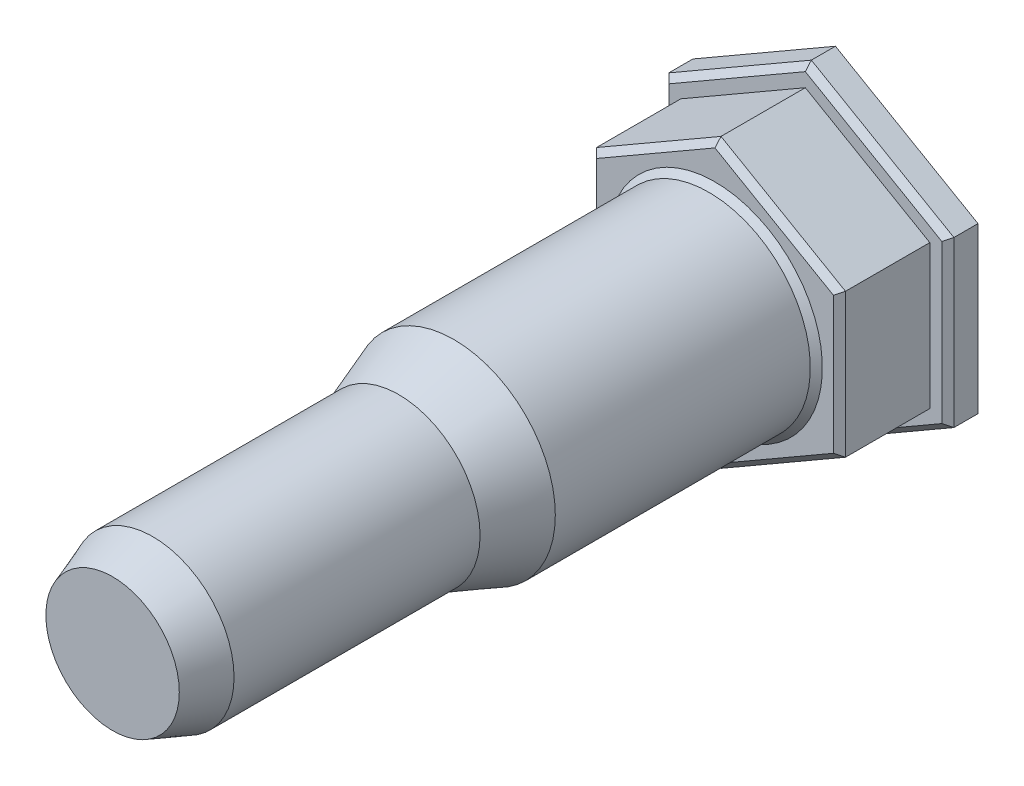
from build123d import *

# Parameters (mm, degrees)
BOSS_EXTRUDE1_DEPTH = 1.5
SKETCH1_8_R         = 4.05
BOSS_EXTRUDE3_DEPTH = 36
SKETCH1_9_R         = 5.05
BOSS_EXTRUDE4_DEPTH = 19
SHELL1_START        = 2
SHELL1_OUTLINE_R    = 3.05
SHELL1_DEPTH        = 15
SHELL1_START_2      = 17
SHELL1_2_OUTLINE_R  = 2.05
SHELL1_2_DEPTH      = 17
SKETCH1_10_R        = 3.05
CUT_EXTRUDE1_DEPTH  = 11
SKETCH1_3_R         = 3.05
BOSS_EXTRUDE2_DEPTH = 6
CHAMFER1_SIZE       = 2
CHAMFER1_SIZE2      = 0.727940469
CHAMFER2_SIZE       = 2.747477419
CHAMFER2_SIZE_2     = 1
CHAMFER3_SIZE       = 1.039230485
CHAMFER3_SIZE_2     = 0.6
CHAMFER5_SIZE       = 0.3


# Read off the part's stored shape, not the designer's step: Shell1
with BuildPart() as part:
    # Sketch1 → Boss-Extrude1 (new body)
    with BuildSketch(Plane.XY):
        Polygon((-7.1, 4.099186911), (0, 8.198373822), (7.1, 4.099186911), (7.1, -4.099186911), (0, -8.198373822), (-7.1, -4.099186911), align=None)
    extrude(amount=BOSS_EXTRUDE1_DEPTH)

    # Sketch1<8> → Boss-Extrude3 (add)
    with BuildSketch(Plane.XY):
        with Locations(Location((0, 0, 0), (0, 0, 180))):
            Circle(SKETCH1_8_R)
    extrude(amount=BOSS_EXTRUDE3_DEPTH)

    # Sketch1<9> → Boss-Extrude4 (add)
    with BuildSketch(Plane.XY):
        with Locations(Location((0, 0, 0), (0, 0, 180))):
            Circle(SKETCH1_9_R)
    extrude(amount=BOSS_EXTRUDE4_DEPTH)

    # Shell1 outline → Shell1 (cut)
    with BuildSketch(Plane.XY.offset(SHELL1_START)):
        Circle(SHELL1_OUTLINE_R)
    extrude(amount=SHELL1_DEPTH, mode=Mode.SUBTRACT)

    # Shell1 2 outline → Shell1 2 (cut)
    with BuildSketch(Plane.XY.offset(SHELL1_START_2)):
        Circle(SHELL1_2_OUTLINE_R)
    extrude(amount=SHELL1_2_DEPTH, mode=Mode.SUBTRACT)

    # Sketch1<10> → Cut-Extrude1 (cut)
    with BuildSketch(Plane.XY):
        Circle(SKETCH1_10_R)
    extrude(amount=CUT_EXTRUDE1_DEPTH, mode=Mode.SUBTRACT)

    # Sketch1<3> → Boss-Extrude2 (add)
    with BuildSketch(Plane.XY):
        Polygon((0, 7.159143338), (6.2, 3.579571669), (6.2, -3.579571669), (0, -7.159143338), (-6.2, -3.579571669), (-6.2, 3.579571669), align=None)
        Circle(SKETCH1_3_R, mode=Mode.SUBTRACT)
    extrude(amount=BOSS_EXTRUDE2_DEPTH)

    # Chamfer1
    chamfer1_edges = [part.edges().sort_by_distance(p)[0] for p in [
        (4.05, 0, 36),
    ]]
    chamfer1_side = [part.faces().sort_by_distance(p)[0] for p in [
        (4.05, 0, 27.5),
    ]]
    chamfer(chamfer1_edges, length=CHAMFER1_SIZE, length2=CHAMFER1_SIZE2, reference=chamfer1_side[0])

    # Chamfer2
    # the kernel refuses this chamfer: 2.747477419, 1 mm, written as the material it adds along each edge
    with BuildSketch(Plane(origin=(0, 0, 19), x_dir=(-1, 0, 0), z_dir=(0, -1, 0))) as chamfer2_piece_1_section:
        Polygon((4.05, -CHAMFER2_SIZE), (4.05 + CHAMFER2_SIZE_2, 0), (4.05, 0), align=None)
    chamfer2_piece_1 = revolve(axis=Axis((0, 0, 19), (0, 0, -1)), mode=Mode.PRIVATE)
    chamfer2_piece_1 = chamfer2_piece_1 & Plane(origin=(0, 0, 20.413276919), x_dir=(-1, 0, 0), z_dir=(0, 0, -1)) * Cylinder(5.05, 21, mode=Mode.PRIVATE)
    add(chamfer2_piece_1)

    # Chamfer3
    # the kernel refuses this chamfer: 1.039230485, 0.6 mm, written as the material it takes off along each edge
    with BuildSketch(Plane(origin=(0, 0, 17), x_dir=(1, 0, 0), z_dir=(0, -1, 0))) as chamfer3_piece_1_section:
        Polygon((2.05 + CHAMFER3_SIZE, 0), (2.05, CHAMFER3_SIZE_2), (2.05, 0), align=None)
    chamfer3_piece_1 = revolve(axis=Axis((0, 0, 17), (0, 0, 1)), mode=Mode.PRIVATE)
    chamfer3_piece_1 = chamfer3_piece_1 & Plane(origin=(0, 0, 17.306641595), x_dir=(1, 0, 0), z_dir=(0, 0, -1)) * Cylinder(3.05, 13, mode=Mode.PRIVATE)
    add(chamfer3_piece_1, mode=Mode.SUBTRACT)

    # Chamfer5
    chamfer5_edges = [part.edges().sort_by_distance(p)[0] for p in [
        (3.55, 6.148780367, 1.5),
        (7.1, 0, 1.5),
        (3.55, -6.148780367, 1.5),
        (-3.55, -6.148780367, 1.5),
        (5.05, 0, 6),
        (-7.1, 0, 1.5),
        (-3.1, -5.369357503, 6),
        (3.1, -5.369357503, 6),
        (6.2, 0, 6),
        (3.1, 5.369357503, 6),
        (-3.1, 5.369357503, 6),
        (-6.2, 0, 6),
        (-3.55, 6.148780367, 1.5),
    ]]
    chamfer(chamfer5_edges, length=CHAMFER5_SIZE)


solid = part.part
